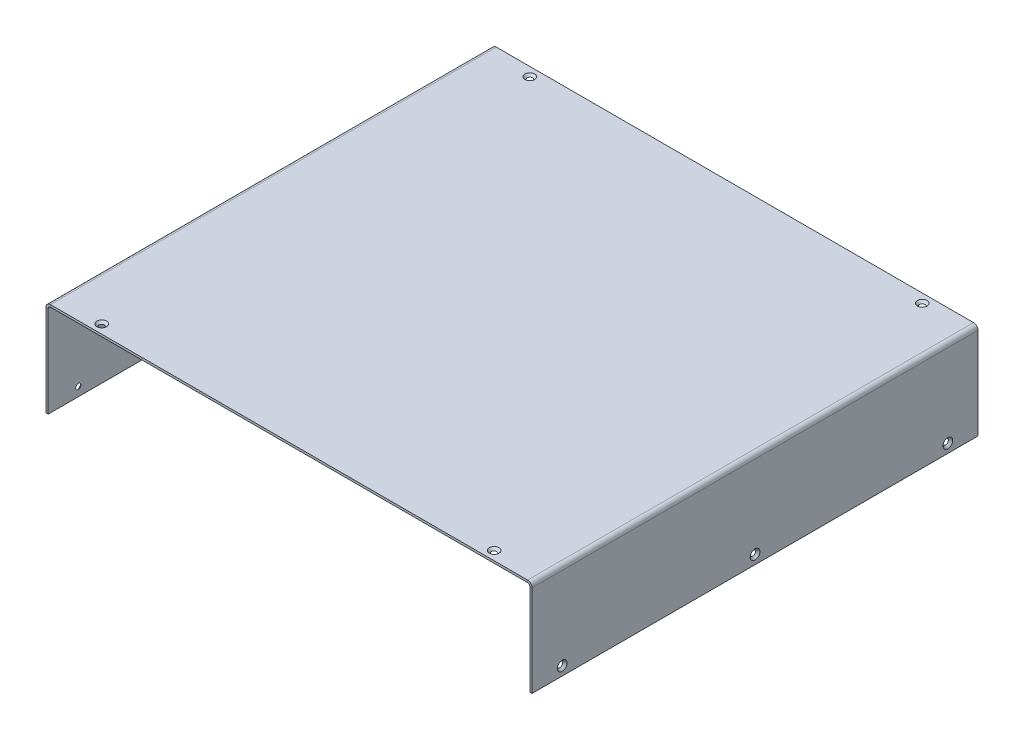
from build123d import *

# Parameters (mm, degrees)
SM_BASE_FLANGE_1_DEPTH = 400
SKETCH_8_R             = 2.3
CUT_EXTRUDE_2_DEPTH    = 598.920738894
SKETCH_9_R             = 2.3
CUT_EXTRUDE_3_DEPTH    = 10
CHAMFER_1_SIZE         = 2.05


# Sheet-metal steps are written as plain solids
with BuildPart() as part:
    # Sketch 1 → Базовая кромка1 (new body)
    with BuildSketch(Plane.XY):
        with BuildLine():
            Line((0, 0), (0, 82.1))
            ThreePointArc((0, 82.1), (-1.171572875, 84.928427125), (-4, 86.1))
            Line((-4, 86.1), (-432, 86.1))
            ThreePointArc((-432, 86.1), (-434.828427125, 84.928427125), (-436, 82.1))
            Line((-436, 82.1), (-436, 0))
            Line((-436, 0), (-434, 0))
            Line((-434, 0), (-434, 82.1))
            ThreePointArc((-434, 82.1), (-433.414213562, 83.514213562), (-432, 84.1))
            Line((-432, 84.1), (-4, 84.1))
            ThreePointArc((-4, 84.1), (-2.585786438, 83.514213562), (-2, 82.1))
            Line((-2, 82.1), (-2, 0))
            Line((-2, 0), (0, 0))
        make_face()
    extrude(amount=SM_BASE_FLANGE_1_DEPTH)

    # Эскиз8 → Вырез-Вытянуть2 (cut, through all)
    with BuildSketch(Plane(origin=(0, 0, 0), x_dir=(0, 0, -1), z_dir=(1, 0, 0))):
        with Locations(Location((-373, 8, 0), (0, 0, 90))):
            Circle(SKETCH_8_R)
        with Locations(Location((-200, 8, 0), (0, 0, 90))):
            Circle(SKETCH_8_R)
        with Locations(Location((-27, 8, 0), (0, 0, 90))):
            Circle(SKETCH_8_R)
    extrude(amount=-CUT_EXTRUDE_2_DEPTH, mode=Mode.SUBTRACT)

    # Эскиз9 → Вырез-Вытянуть3 (cut)
    with BuildSketch(Plane(origin=(0, 86.1, 0), x_dir=(1, 0, 0), z_dir=(0, 1, 0))):
        with Locations(Location((-42, -392, 0), (0, 0, 180))):
            Circle(SKETCH_9_R)
        with Locations(Location((-394, -392, 0), (0, 0, 180))):
            Circle(SKETCH_9_R)
        with Locations(Location((-42, -8, 0), (0, 0, 180))):
            Circle(SKETCH_9_R)
        with Locations(Location((-394, -8, 0), (0, 0, 180))):
            Circle(SKETCH_9_R)
    extrude(amount=-CUT_EXTRUDE_3_DEPTH, mode=Mode.SUBTRACT)

    # Фаска1
    # the kernel refuses this chamfer: 2.05 mm, written as the material it takes off along each edge
    with BuildSketch(Plane(origin=(-436, 8, 373), x_dir=(0, 1, 0), z_dir=(0, 0, -1))) as chamfer_1_piece_1:
        Polygon((2.3 + CHAMFER_1_SIZE, 0), (2.3, CHAMFER_1_SIZE), (2.3, 0), align=None)
    revolve(axis=Axis((-436, 8, 373), (1, 0, 0)), mode=Mode.SUBTRACT)
    with BuildSketch(Plane(origin=(0, 8, 373), x_dir=(0, 1, 0), z_dir=(0, 0, -1))) as chamfer_1_piece_2:
        Polygon((2.3, -CHAMFER_1_SIZE), (2.3 + CHAMFER_1_SIZE, 0), (2.3, 0), align=None)
    revolve(axis=Axis((0, 8, 373), (1, 0, 0)), mode=Mode.SUBTRACT)
    with BuildSketch(Plane(origin=(-436, 8, 200), x_dir=(0, 1, 0), z_dir=(0, 0, -1))) as chamfer_1_piece_3:
        Polygon((2.3 + CHAMFER_1_SIZE, 0), (2.3, CHAMFER_1_SIZE), (2.3, 0), align=None)
    revolve(axis=Axis((-436, 8, 200), (1, 0, 0)), mode=Mode.SUBTRACT)
    with BuildSketch(Plane(origin=(0, 8, 200), x_dir=(0, 1, 0), z_dir=(0, 0, -1))) as chamfer_1_piece_4:
        Polygon((2.3, -CHAMFER_1_SIZE), (2.3 + CHAMFER_1_SIZE, 0), (2.3, 0), align=None)
    revolve(axis=Axis((0, 8, 200), (1, 0, 0)), mode=Mode.SUBTRACT)
    with BuildSketch(Plane(origin=(-436, 8, 27), x_dir=(0, 1, 0), z_dir=(0, 0, -1))) as chamfer_1_piece_5:
        Polygon((2.3 + CHAMFER_1_SIZE, 0), (2.3, CHAMFER_1_SIZE), (2.3, 0), align=None)
    revolve(axis=Axis((-436, 8, 27), (1, 0, 0)), mode=Mode.SUBTRACT)
    with BuildSketch(Plane(origin=(0, 8, 27), x_dir=(0, 1, 0), z_dir=(0, 0, -1))) as chamfer_1_piece_6:
        Polygon((2.3, -CHAMFER_1_SIZE), (2.3 + CHAMFER_1_SIZE, 0), (2.3, 0), align=None)
    revolve(axis=Axis((0, 8, 27), (1, 0, 0)), mode=Mode.SUBTRACT)
    with BuildSketch(Plane(origin=(-42, 86.1, 392), x_dir=(-1, 0, 0), z_dir=(0, 0, -1))) as chamfer_1_piece_7:
        Polygon((2.3, -CHAMFER_1_SIZE), (2.3 + CHAMFER_1_SIZE, 0), (2.3, 0), align=None)
    revolve(axis=Axis((-42, 86.1, 392), (0, 1, 0)), mode=Mode.SUBTRACT)
    with BuildSketch(Plane(origin=(-394, 86.1, 392), x_dir=(-1, 0, 0), z_dir=(0, 0, -1))) as chamfer_1_piece_8:
        Polygon((2.3, -CHAMFER_1_SIZE), (2.3 + CHAMFER_1_SIZE, 0), (2.3, 0), align=None)
    revolve(axis=Axis((-394, 86.1, 392), (0, 1, 0)), mode=Mode.SUBTRACT)
    with BuildSketch(Plane(origin=(-42, 86.1, 8), x_dir=(-1, 0, 0), z_dir=(0, 0, -1))) as chamfer_1_piece_9:
        Polygon((2.3, -CHAMFER_1_SIZE), (2.3 + CHAMFER_1_SIZE, 0), (2.3, 0), align=None)
    revolve(axis=Axis((-42, 86.1, 8), (0, 1, 0)), mode=Mode.SUBTRACT)
    with BuildSketch(Plane(origin=(-394, 86.1, 8), x_dir=(-1, 0, 0), z_dir=(0, 0, -1))) as chamfer_1_piece_10:
        Polygon((2.3, -CHAMFER_1_SIZE), (2.3 + CHAMFER_1_SIZE, 0), (2.3, 0), align=None)
    revolve(axis=Axis((-394, 86.1, 8), (0, 1, 0)), mode=Mode.SUBTRACT)


solid = part.part
